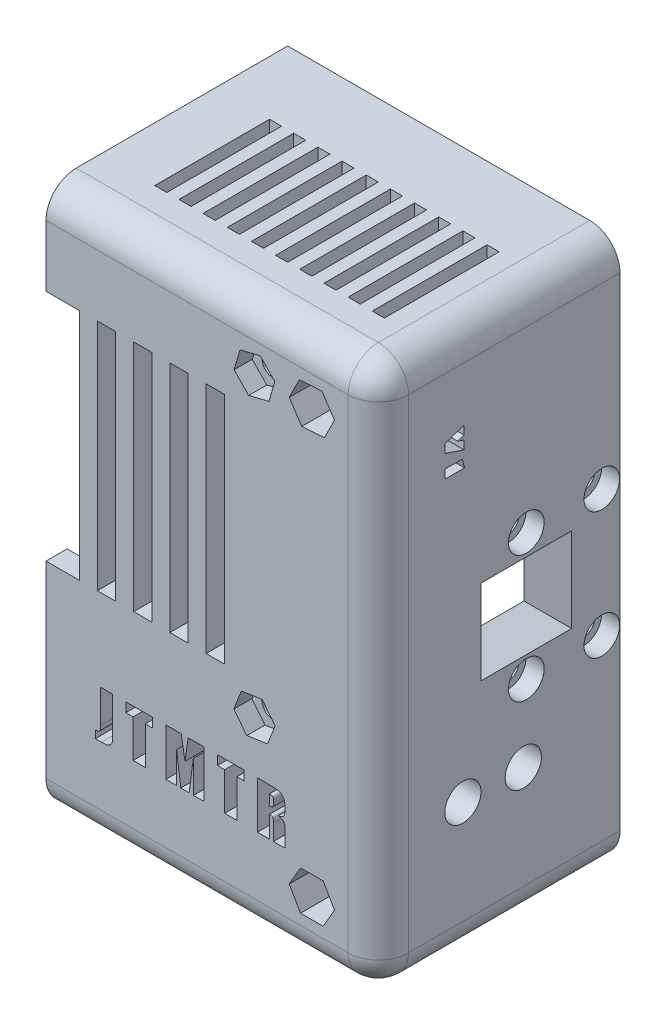
from build123d import *

# Parameters (mm, degrees)
SKETCH1_W                       = 110
SKETCH1_H                       = 90
SKETCH1_R                       = 1.75
BOSS_EXTRUDE1_DEPTH             = 5
SKETCH2_R                       = 3
BOSS_EXTRUDE2_DEPTH             = 8
CUT_EXTRUDE1_REACH              = 78.118
SKETCH3_R                       = 1.5
CUT_EXTRUDE2_DEPTH              = 3
SKETCH5_W                       = 5
SKETCH5_H                       = 90
BOSS_EXTRUDE3_DEPTH             = 35
CUT_EXTRUDE3_REACH              = 121.478
SKETCH6_W                       = 4.5
SKETCH6_H                       = 4
SKETCH6_R                       = 1.75
SKETCH7_R                       = 2.25
BOSS_EXTRUDE4_DEPTH             = 2
CUT_EXTRUDE4_REACH              = 119.724
SKETCH8_R                       = 1.5
SKETCH9_W                       = 105
SKETCH9_H                       = 4
BOSS_EXTRUDE5_DEPTH             = 35
CUT_EXTRUDE7_REACH              = 112.549
SKETCH13_W                      = 50
SKETCH13_H                      = 16
SKETCH15_W                      = 3
SKETCH15_H                      = 19.333856647
CUT_EXTRUDE9_DEPTH              = 10
SKETCH18_R                      = 5
BOSS_EXTRUDE7_DEPTH             = 35
CUT_EXTRUDE10_REACH             = 121.478
SKETCH20_R                      = 3
CUT_EXTRUDE11_REACH             = 87
SKETCH21_R                      = 1.75
CUT_EXTRUDE12_DEPTH             = 30
CUT_EXTRUDE13_REACH             = 112.549
SKETCH23_R                      = 2
CUT_EXTRUDE13_DIRECTION_2_REACH = 112.549
CUT_EXTRUDE14_DEPTH             = 3
CUT_EXTRUDE15_DEPTH             = 3
SKETCH27_R                      = 2.5
BOSS_EXTRUDE9_DEPTH             = 10
SKETCH28_R                      = 0.9
BOSS_EXTRUDE10_DEPTH            = 3
SKETCH29_W                      = 2
SKETCH29_H                      = 82
BOSS_EXTRUDE11_DEPTH            = 10
CUT_EXTRUDE16_DEPTH             = 10
FILLET3_R                       = 5
CUT_EXTRUDE17_START             = -10.5
CUT_EXTRUDE17_OUTLINE_W         = 38.667713294
CUT_EXTRUDE17_OUTLINE_H         = 5
CUT_EXTRUDE17_DEPTH             = 21
CUT_EXTRUDE17_START_2           = 55
CUT_EXTRUDE17_2_OUTLINE_W       = 38.667713294
CUT_EXTRUDE17_2_OUTLINE_H       = 5
CUT_EXTRUDE17_2_DEPTH           = 5
CUT_EXTRUDE17_START_3           = -51
CUT_EXTRUDE17_3_DEPTH           = 106.760910182
CUT_EXTRUDE17_4_ANGLE           = 90
CUT_EXTRUDE17_5_OUTLINE_W       = 5
CUT_EXTRUDE17_5_OUTLINE_H       = 38.667713294
CUT_EXTRUDE17_5_ANGLE           = 90
CHAMFER1_SIZE                   = 3
CHAMFER1_SIZE_2                 = 5.196152423
SKETCH34_W                      = 2
SKETCH34_H                      = 82
BOSS_EXTRUDE12_DEPTH            = 25
SKETCH35_W                      = 1
SKETCH35_H                      = 82
CUT_EXTRUDE18_DEPTH             = 10
CUT_EXTRUDE19_REACH             = 124.123
SKETCH36_W                      = 20
SKETCH36_H                      = 39
CUT_EXTRUDE21_REACH             = 84.765
SKETCH38_W                      = 14.5
SKETCH38_H                      = 10
CUT_EXTRUDE22_DEPTH             = 5
CUT_EXTRUDE30_DEPTH             = 5
CUT_EXTRUDE31_DEPTH             = 83.764726786
CUT_EXTRUDE31_DEPTH_BACK        = 83.764726786
SKETCH44_W                      = 55
SKETCH44_H                      = 90
SKETCH45_W                      = 26.5
SKETCH45_H                      = 86.0117121
CUT_EXTRUDE32_DEPTH             = 5
SKETCH46_W                      = 10
SKETCH46_H                      = 10
SKETCH46_H_2                    = 8
SKETCH46_H_3                    = 2
BOSS_EXTRUDE13_DEPTH            = 4
SKETCH47_W                      = 2
SKETCH47_H                      = 19
CUT_EXTRUDE33_DEPTH             = 10
SKETCH48_R                      = 2.95
CUT_EXTRUDE36_DEPTH             = 3
BOSS_EXTRUDE14_START            = -35
BOSS_EXTRUDE14_DEPTH            = 35


with BuildPart() as part:
    # Sketch1 → Boss-Extrude1 (new body)
    with BuildSketch(Plane.XY):
        with Locations((5, 0)):
            Rectangle(SKETCH1_W, SKETCH1_H)
        with Locations((39.5, 35)):
            Circle(SKETCH1_R, mode=Mode.SUBTRACT)
        with Locations((-18.5, 35)):
            Circle(SKETCH1_R, mode=Mode.SUBTRACT)
        with Locations((-18.5, -14)):
            Circle(SKETCH1_R, mode=Mode.SUBTRACT)
        with Locations((39.5, -14)):
            Circle(SKETCH1_R, mode=Mode.SUBTRACT)
    extrude(amount=BOSS_EXTRUDE1_DEPTH)

    # Sketch2 → Boss-Extrude2 (add)
    with BuildSketch(Plane(origin=(0, 0, 0), x_dir=(-1, 0, 0), z_dir=(0, 0, -1))):
        with Locations(Location((-39.5, 35, 0), (0, 0, 180))):
            Circle(SKETCH2_R)
        with Locations(Location((-39.5, -14, 0), (0, 0, 180))):
            Circle(SKETCH2_R)
        with Locations(Location((18.5, -14, 0), (0, 0, 180))):
            Circle(SKETCH2_R)
        with Locations(Location((18.5, 35, 0), (0, 0, 180))):
            Circle(SKETCH2_R)
    extrude(amount=BOSS_EXTRUDE2_DEPTH)

    # Sketch3 → Cut-Extrude1 (cut, up to next)
    with BuildSketch(Plane(origin=(0, 0, -8), x_dir=(-1, 0, 0), z_dir=(0, 0, -1)), mode=Mode.PRIVATE) as cut_extrude1_sk1:
        with Locations((-39.5, 35)):
            Circle(SKETCH3_R)
    cut_extrude1_tool1 = extrude(cut_extrude1_sk1.sketch, amount=-CUT_EXTRUDE1_REACH, mode=Mode.PRIVATE) & part.part
    # Sketch3 → Cut-Extrude1 (cut, up to next)
    with BuildSketch(Plane(origin=(0, 0, -8), x_dir=(-1, 0, 0), z_dir=(0, 0, -1)), mode=Mode.PRIVATE) as cut_extrude1_sk2:
        with Locations((18.5, 35)):
            Circle(SKETCH3_R)
    cut_extrude1_tool2 = extrude(cut_extrude1_sk2.sketch, amount=-CUT_EXTRUDE1_REACH, mode=Mode.PRIVATE) & part.part
    # Sketch3 → Cut-Extrude1 (cut, up to next)
    with BuildSketch(Plane(origin=(0, 0, -8), x_dir=(-1, 0, 0), z_dir=(0, 0, -1)), mode=Mode.PRIVATE) as cut_extrude1_sk3:
        with Locations((18.5, -14)):
            Circle(SKETCH3_R)
    cut_extrude1_tool3 = extrude(cut_extrude1_sk3.sketch, amount=-CUT_EXTRUDE1_REACH, mode=Mode.PRIVATE) & part.part
    # Sketch3 → Cut-Extrude1 (cut, up to next)
    with BuildSketch(Plane(origin=(0, 0, -8), x_dir=(-1, 0, 0), z_dir=(0, 0, -1)), mode=Mode.PRIVATE) as cut_extrude1_sk4:
        with Locations((-39.5, -14)):
            Circle(SKETCH3_R)
    cut_extrude1_tool4 = extrude(cut_extrude1_sk4.sketch, amount=-CUT_EXTRUDE1_REACH, mode=Mode.PRIVATE) & part.part
    add(cut_extrude1_tool1.solids().sort_by_distance((39.5, 35, -8))[0], mode=Mode.SUBTRACT)
    add(cut_extrude1_tool2.solids().sort_by_distance((-18.5, 35, -8))[0], mode=Mode.SUBTRACT)
    add(cut_extrude1_tool3.solids().sort_by_distance((-18.5, -14, -8))[0], mode=Mode.SUBTRACT)
    add(cut_extrude1_tool4.solids().sort_by_distance((39.5, -14, -8))[0], mode=Mode.SUBTRACT)

    # Sketch4 → Cut-Extrude2 (cut)
    with BuildSketch(Plane.XY.offset(5)):
        Polygon((-21.354132917, 33.036858311), (-18.226935885, 31.546677543), (-15.372802968, 33.509819232), (-15.645867083, 36.963141689), (-18.773064115, 38.453322457), (-21.627197032, 36.490180768), align=None)
        Polygon((38.538923104, 31.671887742), (41.901691314, 32.503626864), (42.86276821, 35.831739122), (40.461076896, 38.328112258), (37.098308686, 37.496373136), (36.13723179, 34.168260878), align=None)
        Polygon((38.235847366, -17.225200477), (41.661029228, -16.707388534), (42.925181863, -13.482188057), (40.764152634, -10.774799523), (37.338970772, -11.292611466), (36.074818137, -14.517811943), align=None)
        Polygon((-19.700941245, -17.249267629), (-16.286522312, -16.664679441), (-15.085581067, -13.415411812), (-17.299058755, -10.750732371), (-20.713477688, -11.335320559), (-21.914418933, -14.584588188), align=None)
    extrude(amount=-CUT_EXTRUDE2_DEPTH, mode=Mode.SUBTRACT)

    # Sketch5 → Boss-Extrude3 (add)
    with BuildSketch(Plane(origin=(0, 0, 0), x_dir=(-1, 0, 0), z_dir=(0, 0, -1))):
        with Locations((-57.5, 0)):
            Rectangle(SKETCH5_W, SKETCH5_H)
    extrude(amount=BOSS_EXTRUDE3_DEPTH)

    # Sketch6 → Cut-Extrude3 (cut, up to next)
    with BuildSketch(Plane.ZY.offset(-55), mode=Mode.PRIVATE) as cut_extrude3_sk1:
        with Locations((-17.25, -2)):
            Rectangle(SKETCH6_W, SKETCH6_H)
    cut_extrude3_tool1 = extrude(cut_extrude3_sk1.sketch, amount=-CUT_EXTRUDE3_REACH, mode=Mode.PRIVATE) & part.part
    # Sketch6 → Cut-Extrude3 (cut, up to next)
    with BuildSketch(Plane.ZY.offset(-55), mode=Mode.PRIVATE) as cut_extrude3_sk2:
        with Locations((-17.25, 2)):
            Rectangle(SKETCH6_W, SKETCH6_H)
    cut_extrude3_tool2 = extrude(cut_extrude3_sk2.sketch, amount=-CUT_EXTRUDE3_REACH, mode=Mode.PRIVATE) & part.part
    # Sketch6 → Cut-Extrude3 (cut, up to next)
    with BuildSketch(Plane.ZY.offset(-55), mode=Mode.PRIVATE) as cut_extrude3_sk3:
        with Locations((-21.75, 2)):
            Rectangle(SKETCH6_W, SKETCH6_H)
    cut_extrude3_tool3 = extrude(cut_extrude3_sk3.sketch, amount=-CUT_EXTRUDE3_REACH, mode=Mode.PRIVATE) & part.part
    # Sketch6 → Cut-Extrude3 (cut, up to next)
    with BuildSketch(Plane.ZY.offset(-55), mode=Mode.PRIVATE) as cut_extrude3_sk4:
        with Locations((-21.75, -2)):
            Rectangle(SKETCH6_W, SKETCH6_H)
    cut_extrude3_tool4 = extrude(cut_extrude3_sk4.sketch, amount=-CUT_EXTRUDE3_REACH, mode=Mode.PRIVATE) & part.part
    # Sketch6 → Cut-Extrude3 (cut, up to next)
    with BuildSketch(Plane.ZY.offset(-55), mode=Mode.PRIVATE) as cut_extrude3_sk5:
        with Locations(Location((-32, -10.5, 0), (0, 0, 270))):
            Circle(SKETCH6_R)
    cut_extrude3_tool5 = extrude(cut_extrude3_sk5.sketch, amount=-CUT_EXTRUDE3_REACH, mode=Mode.PRIVATE) & part.part
    # Sketch6 → Cut-Extrude3 (cut, up to next)
    with BuildSketch(Plane.ZY.offset(-55), mode=Mode.PRIVATE) as cut_extrude3_sk6:
        with Locations(Location((-32, 10.5, 0), (0, 0, 270))):
            Circle(SKETCH6_R)
    cut_extrude3_tool6 = extrude(cut_extrude3_sk6.sketch, amount=-CUT_EXTRUDE3_REACH, mode=Mode.PRIVATE) & part.part
    # Sketch6 → Cut-Extrude3 (cut, up to next)
    with BuildSketch(Plane.ZY.offset(-55), mode=Mode.PRIVATE) as cut_extrude3_sk7:
        with Locations(Location((-19.5, 10.5, 0), (0, 0, 270))):
            Circle(SKETCH6_R)
    cut_extrude3_tool7 = extrude(cut_extrude3_sk7.sketch, amount=-CUT_EXTRUDE3_REACH, mode=Mode.PRIVATE) & part.part
    # Sketch6 → Cut-Extrude3 (cut, up to next)
    with BuildSketch(Plane.ZY.offset(-55), mode=Mode.PRIVATE) as cut_extrude3_sk8:
        with Locations(Location((-19.5, -10.5, 0), (0, 0, 270))):
            Circle(SKETCH6_R)
    cut_extrude3_tool8 = extrude(cut_extrude3_sk8.sketch, amount=-CUT_EXTRUDE3_REACH, mode=Mode.PRIVATE) & part.part
    add(cut_extrude3_tool1.solids().sort_by_distance((55, -2, -17.25))[0], mode=Mode.SUBTRACT)
    add(cut_extrude3_tool2.solids().sort_by_distance((55, 2, -17.25))[0], mode=Mode.SUBTRACT)
    add(cut_extrude3_tool3.solids().sort_by_distance((55, 2, -21.75))[0], mode=Mode.SUBTRACT)
    add(cut_extrude3_tool4.solids().sort_by_distance((55, -2, -21.75))[0], mode=Mode.SUBTRACT)
    add(cut_extrude3_tool5.solids().sort_by_distance((55, -10.5, -32))[0], mode=Mode.SUBTRACT)
    add(cut_extrude3_tool6.solids().sort_by_distance((55, 10.5, -32))[0], mode=Mode.SUBTRACT)
    add(cut_extrude3_tool7.solids().sort_by_distance((55, 10.5, -19.5))[0], mode=Mode.SUBTRACT)
    add(cut_extrude3_tool8.solids().sort_by_distance((55, -10.5, -19.5))[0], mode=Mode.SUBTRACT)

    # Sketch7 → Boss-Extrude4 (add)
    with BuildSketch(Plane.ZY.offset(-55)):
        with Locations(Location((-19.5, 10.5, 0), (0, 0, 90))):
            Circle(SKETCH7_R)
        with Locations(Location((-19.5, -10.5, 0), (0, 0, 90))):
            Circle(SKETCH7_R)
        with Locations(Location((-32, -10.5, 0), (0, 0, 90))):
            Circle(SKETCH7_R)
        with Locations(Location((-32, 10.5, 0), (0, 0, 90))):
            Circle(SKETCH7_R)
    extrude(amount=BOSS_EXTRUDE4_DEPTH)

    # Sketch8 → Cut-Extrude4 (cut, up to next)
    with BuildSketch(Plane.ZY.offset(-53), mode=Mode.PRIVATE) as cut_extrude4_sk1:
        with Locations(Location((-32, 10.5, 0), (0, 0, 270))):
            Circle(SKETCH8_R)
    cut_extrude4_tool1 = extrude(cut_extrude4_sk1.sketch, amount=-CUT_EXTRUDE4_REACH, mode=Mode.PRIVATE) & part.part
    # Sketch8 → Cut-Extrude4 (cut, up to next)
    with BuildSketch(Plane.ZY.offset(-53), mode=Mode.PRIVATE) as cut_extrude4_sk2:
        with Locations(Location((-19.5, 10.5, 0), (0, 0, 270))):
            Circle(SKETCH8_R)
    cut_extrude4_tool2 = extrude(cut_extrude4_sk2.sketch, amount=-CUT_EXTRUDE4_REACH, mode=Mode.PRIVATE) & part.part
    # Sketch8 → Cut-Extrude4 (cut, up to next)
    with BuildSketch(Plane.ZY.offset(-53), mode=Mode.PRIVATE) as cut_extrude4_sk3:
        with Locations(Location((-19.5, -10.5, 0), (0, 0, 270))):
            Circle(SKETCH8_R)
    cut_extrude4_tool3 = extrude(cut_extrude4_sk3.sketch, amount=-CUT_EXTRUDE4_REACH, mode=Mode.PRIVATE) & part.part
    # Sketch8 → Cut-Extrude4 (cut, up to next)
    with BuildSketch(Plane.ZY.offset(-53), mode=Mode.PRIVATE) as cut_extrude4_sk4:
        with Locations(Location((-32, -10.5, 0), (0, 0, 270))):
            Circle(SKETCH8_R)
    cut_extrude4_tool4 = extrude(cut_extrude4_sk4.sketch, amount=-CUT_EXTRUDE4_REACH, mode=Mode.PRIVATE) & part.part
    add(cut_extrude4_tool1.solids().sort_by_distance((53, 10.5, -32))[0], mode=Mode.SUBTRACT)
    add(cut_extrude4_tool2.solids().sort_by_distance((53, 10.5, -19.5))[0], mode=Mode.SUBTRACT)
    add(cut_extrude4_tool3.solids().sort_by_distance((53, -10.5, -19.5))[0], mode=Mode.SUBTRACT)
    add(cut_extrude4_tool4.solids().sort_by_distance((53, -10.5, -32))[0], mode=Mode.SUBTRACT)

    # Sketch9 → Boss-Extrude5 (add)
    with BuildSketch(Plane(origin=(0, 0, 0), x_dir=(-1, 0, 0), z_dir=(0, 0, -1))):
        with Locations((-2.5, 43)):
            Rectangle(SKETCH9_W, SKETCH9_H)
        with Locations((-2.5, -43)):
            Rectangle(SKETCH9_W, SKETCH9_H)
    extrude(amount=BOSS_EXTRUDE5_DEPTH)

    # Sketch13 → Cut-Extrude7 (cut, up to next)
    with BuildSketch(Plane(origin=(0, -41, 0), x_dir=(1, 0, 0), z_dir=(0, 1, 0)), mode=Mode.PRIVATE) as cut_extrude7_sk1:
        with Locations((18, 12)):
            Rectangle(SKETCH13_W, SKETCH13_H)
    cut_extrude7_tool1 = extrude(cut_extrude7_sk1.sketch, amount=-CUT_EXTRUDE7_REACH, mode=Mode.PRIVATE) & part.part
    add(cut_extrude7_tool1.solids().sort_by_distance((18, -41, -12))[0], mode=Mode.SUBTRACT)

    # Sketch15 → Cut-Extrude9 (cut)
    with BuildSketch(Plane.XY.offset(5)):
        with Locations((-15, 0.833071676)):
            Rectangle(SKETCH15_W, SKETCH15_H)
        with Locations((-9, 0.833071676)):
            Rectangle(SKETCH15_W, SKETCH15_H)
        with Locations((-3, 0.833071676)):
            Rectangle(SKETCH15_W, SKETCH15_H)
        with Locations((3, 0.833071676)):
            Rectangle(SKETCH15_W, SKETCH15_H)
        with Locations((9, 0.833071676)):
            Rectangle(SKETCH15_W, SKETCH15_H)
        with Locations((15, 0.833071676)):
            Rectangle(SKETCH15_W, SKETCH15_H)
        with Locations((21, 0.833071676)):
            Rectangle(SKETCH15_W, SKETCH15_H)
        with Locations((27, 0.833071676)):
            Rectangle(SKETCH15_W, SKETCH15_H)
        with Locations((33, 0.833071676)):
            Rectangle(SKETCH15_W, SKETCH15_H)
        with Locations((-15, 20.166928324)):
            Rectangle(SKETCH15_W, SKETCH15_H)
        with Locations((-9, 20.166928324)):
            Rectangle(SKETCH15_W, SKETCH15_H)
        with Locations((-3, 20.166928324)):
            Rectangle(SKETCH15_W, SKETCH15_H)
        with Locations((3, 20.166928324)):
            Rectangle(SKETCH15_W, SKETCH15_H)
        with Locations((9, 20.166928324)):
            Rectangle(SKETCH15_W, SKETCH15_H)
        with Locations((15, 20.166928324)):
            Rectangle(SKETCH15_W, SKETCH15_H)
        with Locations((21, 20.166928324)):
            Rectangle(SKETCH15_W, SKETCH15_H)
        with Locations((27, 20.166928324)):
            Rectangle(SKETCH15_W, SKETCH15_H)
        with Locations((33, 20.166928324)):
            Rectangle(SKETCH15_W, SKETCH15_H)
    extrude(amount=-CUT_EXTRUDE9_DEPTH, mode=Mode.SUBTRACT)

    # Sketch18 → Boss-Extrude7 (add)
    with BuildSketch(Plane(origin=(0, 0, 0), x_dir=(-1, 0, 0), z_dir=(0, 0, -1))):
        with Locations(Location((-49, -35, 0), (0, 0, 180))):
            Circle(SKETCH18_R)
        with Locations(Location((-49, 35, 0), (0, 0, 180))):
            Circle(SKETCH18_R)
    extrude(amount=BOSS_EXTRUDE7_DEPTH)

    # Sketch20 → Cut-Extrude10 (cut, up to next)
    with BuildSketch(Plane.ZY.offset(-55), mode=Mode.PRIVATE) as cut_extrude10_sk1:
        with Locations(Location((-19, -22.892244298, 0), (0, 0, 270))):
            Circle(SKETCH20_R)
    cut_extrude10_tool1 = extrude(cut_extrude10_sk1.sketch, amount=-CUT_EXTRUDE10_REACH, mode=Mode.PRIVATE) & part.part
    # Sketch20 → Cut-Extrude10 (cut, up to next)
    with BuildSketch(Plane.ZY.offset(-55), mode=Mode.PRIVATE) as cut_extrude10_sk2:
        with Locations(Location((-9, -22.892244298, 0), (0, 0, 270))):
            Circle(SKETCH20_R)
    cut_extrude10_tool2 = extrude(cut_extrude10_sk2.sketch, amount=-CUT_EXTRUDE10_REACH, mode=Mode.PRIVATE) & part.part
    add(cut_extrude10_tool1.solids().sort_by_distance((55, -22.892244, -19))[0], mode=Mode.SUBTRACT)
    add(cut_extrude10_tool2.solids().sort_by_distance((55, -22.892244, -9))[0], mode=Mode.SUBTRACT)

    # Sketch21 → Cut-Extrude11 (cut, up to next)
    with BuildSketch(Plane(origin=(0, 0, -35), x_dir=(-1, 0, 0), z_dir=(0, 0, -1)), mode=Mode.PRIVATE) as cut_extrude11_sk1:
        with Locations((-49, 35)):
            Circle(SKETCH21_R)
    cut_extrude11_tool1 = extrude(cut_extrude11_sk1.sketch, amount=-CUT_EXTRUDE11_REACH, mode=Mode.PRIVATE) & part.part
    # Sketch21 → Cut-Extrude11 (cut, up to next)
    with BuildSketch(Plane(origin=(0, 0, -35), x_dir=(-1, 0, 0), z_dir=(0, 0, -1)), mode=Mode.PRIVATE) as cut_extrude11_sk2:
        with Locations((-49, -35)):
            Circle(SKETCH21_R)
    cut_extrude11_tool2 = extrude(cut_extrude11_sk2.sketch, amount=-CUT_EXTRUDE11_REACH, mode=Mode.PRIVATE) & part.part
    add(cut_extrude11_tool1.solids().sort_by_distance((49, 35, -35))[0], mode=Mode.SUBTRACT)
    add(cut_extrude11_tool2.solids().sort_by_distance((49, -35, -35))[0], mode=Mode.SUBTRACT)

    # Sketch22 → Cut-Extrude12 (cut)
    with BuildSketch(Plane.XY.offset(5)):
        Polygon((46.919353747, 38.12317859), (45.254924874, 34.759696783), (47.335571127, 31.636518194), (51.080646253, 31.87682141), (52.745075126, 35.240303217), (50.664428873, 38.363481806), align=None)
        Polygon((52.75277675, -35), (50.876388375, -31.75), (47.123611625, -31.75), (45.24722325, -35), (47.123611625, -38.25), (50.876388375, -38.25), align=None)
    extrude(amount=-CUT_EXTRUDE12_DEPTH, mode=Mode.SUBTRACT)

    # Sketch23 → Cut-Extrude13 (cut, up to next)
    with BuildSketch(Plane(origin=(0, -41, 0), x_dir=(1, 0, 0), z_dir=(0, 1, 0)), mode=Mode.PRIVATE) as cut_extrude13_sk1:
        with Locations(Location((-20, 15, 0), (0, 0, 90))):
            Circle(SKETCH23_R)
    cut_extrude13_tool1 = extrude(cut_extrude13_sk1.sketch, amount=-CUT_EXTRUDE13_REACH, mode=Mode.PRIVATE) & part.part
    add(cut_extrude13_tool1.solids().sort_by_distance((-20, -41, -15))[0], mode=Mode.SUBTRACT)

    # Sketch23 → Cut-Extrude13 direction 2 (cut, up to next)
    with BuildSketch(Plane(origin=(0, -41, 0), x_dir=(1, 0, 0), z_dir=(0, 1, 0)), mode=Mode.PRIVATE) as cut_extrude13_direction_2_sk1:
        with Locations(Location((-20, 15, 0), (0, 0, 90))):
            Circle(SKETCH23_R)
    cut_extrude13_direction_2_tool1 = extrude(cut_extrude13_direction_2_sk1.sketch, amount=CUT_EXTRUDE13_DIRECTION_2_REACH, mode=Mode.PRIVATE) & part.part
    add(cut_extrude13_direction_2_tool1.solids().sort_by_distance((-20, -41, -15))[0], mode=Mode.SUBTRACT)

    # Sketch24 → Cut-Extrude14 (cut)
    with BuildSketch(Plane(origin=(0, 41, 0), x_dir=(-1, 0, 0), z_dir=(0, -1, 0))):
        Polygon((16.535898385, 15), (18.267949192, 12), (21.732050808, 12), (23.464101615, 15), (21.732050808, 18), (18.267949192, 18), align=None)
    extrude(amount=-CUT_EXTRUDE14_DEPTH, mode=Mode.SUBTRACT)

    # Sketch25 → Cut-Extrude15 (cut)
    with BuildSketch(Plane(origin=(0, -41, 0), x_dir=(1, 0, 0), z_dir=(0, 1, 0))):
        Polygon((-23.452057687, 14.711386547), (-21.476082261, 11.866123621), (-18.024024574, 12.154737074), (-16.547942313, 15.288613453), (-18.523917739, 18.133876379), (-21.975975426, 17.845262926), align=None)
    extrude(amount=-CUT_EXTRUDE15_DEPTH, mode=Mode.SUBTRACT)

    # Sketch27 → Boss-Extrude9 (add)
    with BuildSketch(Plane(origin=(0, 0, 0), x_dir=(-1, 0, 0), z_dir=(0, 0, -1))):
        with Locations(Location((4.68, -22, 0), (0, 0, 180))):
            Circle(SKETCH27_R)
        with Locations(Location((4.68, -37.24, 0), (0, 0, 180))):
            Circle(SKETCH27_R)
        with Locations(Location((45.32, -37.24, 0), (0, 0, 180))):
            Circle(SKETCH27_R)
        with Locations(Location((45.32, -22, 0), (0, 0, 180))):
            Circle(SKETCH27_R)
    extrude(amount=BOSS_EXTRUDE9_DEPTH)

    # Sketch28 → Boss-Extrude10 (add)
    with BuildSketch(Plane(origin=(0, 0, -10), x_dir=(-1, 0, 0), z_dir=(0, 0, -1))):
        with Locations((4.68, -22)):
            Circle(SKETCH28_R)
        with Locations((4.68, -37.24)):
            Circle(SKETCH28_R)
        with Locations((45.32, -37.24)):
            Circle(SKETCH28_R)
        with Locations((45.32, -22)):
            Circle(SKETCH28_R)
    extrude(amount=BOSS_EXTRUDE10_DEPTH)

    # Sketch29 → Boss-Extrude11 (add)
    with BuildSketch(Plane(origin=(0, 0, 0), x_dir=(-1, 0, 0), z_dir=(0, 0, -1))):
        with Locations((49, 0)):
            Rectangle(SKETCH29_W, SKETCH29_H)
    extrude(amount=BOSS_EXTRUDE11_DEPTH)

    # Sketch30 → Cut-Extrude16 (cut)
    with BuildSketch(Plane(origin=(0, 0, -35), x_dir=(-1, 0, 0), z_dir=(0, 0, -1))):
        Polygon((-55, 41), (50, 41), (50, 43), (-57, 43), (-57, 15), (-55, 15), align=None)
        Polygon((50, -43), (50, -41), (-55, -41), (-55, -15), (-57, -15), (-57, -43), align=None)
    extrude(amount=-CUT_EXTRUDE16_DEPTH, mode=Mode.SUBTRACT)

    # Fillet3
    fillet3_edges = [part.edges().sort_by_distance(p)[0] for p in [
        (60, 45, -15),
        (60, -45, -15),
    ]]
    fillet(fillet3_edges, radius=FILLET3_R)

    # Cut-Extrude17: read off the stored shape, not the designer's step
    # Cut-Extrude17 outline → Cut-Extrude17 (cut)
    with BuildSketch(Plane.YZ.offset(CUT_EXTRUDE17_START)):
        with BuildLine():
            ThreePointArc((-45, 0), (-43.535533906, 3.535533906), (-40, 5))
            Line((-40, 5), (-45, 5))
            Line((-45, 5), (-45, 0))
        make_face()
        with BuildLine():
            Line((45, 5), (40, 5))
            ThreePointArc((40, 5), (43.535533906, 3.535533906), (45, 0))
            Line((45, 0), (45, 5))
        make_face()
        with Locations((10.5, 2.5)):
            Rectangle(CUT_EXTRUDE17_OUTLINE_W, CUT_EXTRUDE17_OUTLINE_H)
    extrude(amount=CUT_EXTRUDE17_DEPTH, mode=Mode.SUBTRACT)

    # Cut-Extrude17 2 outline → Cut-Extrude17 2 (cut)
    with BuildSketch(Plane.YZ.offset(CUT_EXTRUDE17_START_2)):
        with BuildLine():
            ThreePointArc((-45, 0), (-43.535533906, 3.535533906), (-40, 5))
            Line((-40, 5), (-45, 5))
            Line((-45, 5), (-45, 0))
        make_face()
        with BuildLine():
            Line((45, 5), (40, 5))
            ThreePointArc((40, 5), (43.535533906, 3.535533906), (45, 0))
            Line((45, 0), (45, 5))
        make_face()
        with Locations((10.5, 2.5)):
            Rectangle(CUT_EXTRUDE17_2_OUTLINE_W, CUT_EXTRUDE17_2_OUTLINE_H)
    extrude(amount=CUT_EXTRUDE17_2_DEPTH, mode=Mode.SUBTRACT)

    # Cut-Extrude17 3 outline → Cut-Extrude17 3 (cut)
    with BuildSketch(Plane.YZ.offset(CUT_EXTRUDE17_START_3)):
        with BuildLine():
            ThreePointArc((-45, 0), (-43.535533906, 3.535533906), (-40, 5))
            Line((-40, 5), (-45, 5))
            Line((-45, 5), (-45, 0))
        make_face()
        with BuildLine():
            Line((45, 5), (40, 5))
            ThreePointArc((40, 5), (43.535533906, 3.535533906), (45, 0))
            Line((45, 0), (45, 5))
        make_face()
    extrude(amount=CUT_EXTRUDE17_3_DEPTH, mode=Mode.SUBTRACT)

    # Cut-Extrude17 4 outline → Cut-Extrude17 4 (revolve, cut)
    with BuildSketch(Plane.ZY.offset(-55)):
        with BuildLine():
            Line((7.071067812, 45), (0, 45))
            ThreePointArc((0, 45), (3.535533906, 43.535533906), (5, 40))
            Line((5, 40), (5, 29.833856647))
            Line((5, 29.833856647), (7.071067812, 29.833856647))
            Line((7.071067812, 29.833856647), (7.071067812, 45))
        make_face()
        with BuildLine():
            Line((7.071067812, -8.833856647), (5, -8.833856647))
            Line((5, -8.833856647), (5, -40))
            ThreePointArc((5, -40), (3.535533906, -43.535533906), (0, -45))
            Line((0, -45), (7.071067812, -45))
            Line((7.071067812, -45), (7.071067812, -8.833856647))
        make_face()
    revolve(axis=Axis((55, 0, 0), (0, 1, 0)), revolution_arc=CUT_EXTRUDE17_4_ANGLE, mode=Mode.SUBTRACT)

    # Cut-Extrude17 5 outline → Cut-Extrude17 5 (revolve)
    with BuildSketch(Plane.ZY.offset(-55)):
        with Locations((2.5, 10.5)):
            Rectangle(CUT_EXTRUDE17_5_OUTLINE_W, CUT_EXTRUDE17_5_OUTLINE_H)
    revolve(axis=Axis((55, 0, 0), (0, 1, 0)), revolution_arc=CUT_EXTRUDE17_5_ANGLE)

    # Chamfer1
    # the kernel refuses this chamfer: 5.196152423, 3 mm, written as the material it takes off along each edge
    with BuildSketch(Plane(origin=(60, -4, -15), x_dir=(0, 0, 1), z_dir=(0, 1, 0)), Plane(origin=(60, 4, -24), x_dir=(0, 0, -1), z_dir=(0, -1, 0))) as chamfer1_piece_1:
        Polygon((CHAMFER1_SIZE, 0), (0, -CHAMFER1_SIZE_2), (0, 0), align=None)
    extrude(amount=8, mode=Mode.SUBTRACT)
    with BuildSketch(Plane(origin=(60, 4, -15), x_dir=(0, 1, 0), z_dir=(0, 0, -1)), Plane(origin=(60, -4, -24), x_dir=(0, -1, 0), z_dir=(0, 0, 1))) as chamfer1_piece_2:
        Polygon((CHAMFER1_SIZE, 0), (0, -CHAMFER1_SIZE_2), (0, 0), align=None)
    extrude(amount=9, mode=Mode.SUBTRACT)
    with BuildSketch(Plane(origin=(60, -4, -24), x_dir=(0, -1, 0), z_dir=(0, 0, 1))) as chamfer1_piece_3a_section:
        Polygon((CHAMFER1_SIZE, 0), (0, -CHAMFER1_SIZE_2), (0, 0), align=None)
    chamfer1_piece_3a = extrude(amount=22.442891912, mode=Mode.PRIVATE)
    chamfer1_piece_3a = split(chamfer1_piece_3a, bisect_by=Plane(origin=(60, -4, -15), z_dir=(0, 0, 1)), keep=Keep.TOP, mode=Mode.PRIVATE)
    with BuildSketch(Plane(origin=(60, -17.442891912, -15), x_dir=(0, 0, 1), z_dir=(0, 1, 0))) as chamfer1_piece_3b_section:
        Polygon((CHAMFER1_SIZE, 0), (0, -CHAMFER1_SIZE_2), (0, 0), align=None)
    chamfer1_piece_3b = extrude(amount=21.442891912, mode=Mode.PRIVATE)
    chamfer1_piece_3b = split(chamfer1_piece_3b, bisect_by=Plane(origin=(60, -4, -15), z_dir=(0, -1, 0)), keep=Keep.TOP, mode=Mode.PRIVATE)
    chamfer1_piece_3 = chamfer1_piece_3a & chamfer1_piece_3b
    add(chamfer1_piece_3, mode=Mode.SUBTRACT)
    with BuildSketch(Plane(origin=(60, 4, -1.557108088), x_dir=(0, 1, 0), z_dir=(0, 0, -1))) as chamfer1_piece_4a_section:
        Polygon((CHAMFER1_SIZE, 0), (0, -CHAMFER1_SIZE_2), (0, 0), align=None)
    chamfer1_piece_4a = extrude(amount=22.442891912, mode=Mode.PRIVATE)
    chamfer1_piece_4a = split(chamfer1_piece_4a, bisect_by=Plane(origin=(60, 4, -15), z_dir=(0, 0, 1)), keep=Keep.TOP, mode=Mode.PRIVATE)
    with BuildSketch(Plane(origin=(60, -4, -15), x_dir=(0, 0, 1), z_dir=(0, 1, 0))) as chamfer1_piece_4b_section:
        Polygon((CHAMFER1_SIZE, 0), (0, -CHAMFER1_SIZE_2), (0, 0), align=None)
    chamfer1_piece_4b = extrude(amount=21.442891912, mode=Mode.PRIVATE)
    chamfer1_piece_4b = split(chamfer1_piece_4b, bisect_by=Plane(origin=(60, 4, -15), z_dir=(0, 1, 0)), keep=Keep.TOP, mode=Mode.PRIVATE)
    chamfer1_piece_4 = chamfer1_piece_4a & chamfer1_piece_4b
    add(chamfer1_piece_4, mode=Mode.SUBTRACT)
    with BuildSketch(Plane(origin=(60, 17.442891912, -24), x_dir=(0, 0, -1), z_dir=(0, -1, 0))) as chamfer1_piece_5a_section:
        Polygon((CHAMFER1_SIZE, 0), (0, -CHAMFER1_SIZE_2), (0, 0), align=None)
    chamfer1_piece_5a = extrude(amount=21.442891912, mode=Mode.PRIVATE)
    chamfer1_piece_5a = split(chamfer1_piece_5a, bisect_by=Plane(origin=(60, 4, -24), z_dir=(0, 1, 0)), keep=Keep.TOP, mode=Mode.PRIVATE)
    with BuildSketch(Plane(origin=(60, 4, -15), x_dir=(0, 1, 0), z_dir=(0, 0, -1))) as chamfer1_piece_5b_section:
        Polygon((CHAMFER1_SIZE, 0), (0, -CHAMFER1_SIZE_2), (0, 0), align=None)
    chamfer1_piece_5b = extrude(amount=22.442891912, mode=Mode.PRIVATE)
    chamfer1_piece_5b = split(chamfer1_piece_5b, bisect_by=Plane(origin=(60, 4, -24), z_dir=(0, 0, -1)), keep=Keep.TOP, mode=Mode.PRIVATE)
    chamfer1_piece_5 = chamfer1_piece_5a & chamfer1_piece_5b
    add(chamfer1_piece_5, mode=Mode.SUBTRACT)
    with BuildSketch(Plane(origin=(60, -4, -37.442891912), x_dir=(0, -1, 0), z_dir=(0, 0, 1))) as chamfer1_piece_6a_section:
        Polygon((CHAMFER1_SIZE, 0), (0, -CHAMFER1_SIZE_2), (0, 0), align=None)
    chamfer1_piece_6a = extrude(amount=22.442891912, mode=Mode.PRIVATE)
    chamfer1_piece_6a = split(chamfer1_piece_6a, bisect_by=Plane(origin=(60, -4, -24), z_dir=(0, 0, -1)), keep=Keep.TOP, mode=Mode.PRIVATE)
    with BuildSketch(Plane(origin=(60, 4, -24), x_dir=(0, 0, -1), z_dir=(0, -1, 0))) as chamfer1_piece_6b_section:
        Polygon((CHAMFER1_SIZE, 0), (0, -CHAMFER1_SIZE_2), (0, 0), align=None)
    chamfer1_piece_6b = extrude(amount=21.442891912, mode=Mode.PRIVATE)
    chamfer1_piece_6b = split(chamfer1_piece_6b, bisect_by=Plane(origin=(60, -4, -24), z_dir=(0, -1, 0)), keep=Keep.TOP, mode=Mode.PRIVATE)
    chamfer1_piece_6 = chamfer1_piece_6a & chamfer1_piece_6b
    add(chamfer1_piece_6, mode=Mode.SUBTRACT)

    # Sketch34 → Boss-Extrude12 (add)
    with BuildSketch(Plane(origin=(0, 0, -10), x_dir=(-1, 0, 0), z_dir=(0, 0, -1))):
        with Locations((49, 0)):
            Rectangle(SKETCH34_W, SKETCH34_H)
    extrude(amount=BOSS_EXTRUDE12_DEPTH)

    # Sketch35 → Cut-Extrude18 (cut)
    with BuildSketch(Plane(origin=(0, 0, -35), x_dir=(-1, 0, 0), z_dir=(0, 0, -1))):
        with Locations((48.5, 0)):
            Rectangle(SKETCH35_W, SKETCH35_H)
    extrude(amount=-CUT_EXTRUDE18_DEPTH, mode=Mode.SUBTRACT)

    # Sketch36 → Cut-Extrude19 (cut, up to next)
    with BuildSketch(Plane(origin=(-48, 0, 0), x_dir=(0, 0, -1), z_dir=(1, 0, 0)), mode=Mode.PRIVATE) as cut_extrude19_sk1:
        with Locations((12.5, -19.5)):
            Rectangle(SKETCH36_W, SKETCH36_H)
    cut_extrude19_tool1 = extrude(cut_extrude19_sk1.sketch, amount=-CUT_EXTRUDE19_REACH, mode=Mode.PRIVATE) & part.part
    # Sketch36 → Cut-Extrude19 (cut, up to next)
    with BuildSketch(Plane(origin=(-48, 0, 0), x_dir=(0, 0, -1), z_dir=(1, 0, 0)), mode=Mode.PRIVATE) as cut_extrude19_sk2:
        with Locations((12.5, 19.5)):
            Rectangle(SKETCH36_W, SKETCH36_H)
    cut_extrude19_tool2 = extrude(cut_extrude19_sk2.sketch, amount=-CUT_EXTRUDE19_REACH, mode=Mode.PRIVATE) & part.part
    add(cut_extrude19_tool1.solids().sort_by_distance((-48, -19.5, -12.5))[0], mode=Mode.SUBTRACT)
    add(cut_extrude19_tool2.solids().sort_by_distance((-48, 19.5, -12.5))[0], mode=Mode.SUBTRACT)

    # Sketch37 → Cut-Extrude21 (cut, up to next)
    with BuildSketch(Plane(origin=(0, 0, 0), x_dir=(-1, 0, 0), z_dir=(0, 0, -1)), mode=Mode.PRIVATE) as cut_extrude21_sk1:
        with BuildLine():
            Line((-16.008983246, -22.399155147), (-16.008983246, -27.618321299))
            add(Edge.make_bspline(
                [(-16.008983246, -27.618321299), (-16.009057182, -27.711622873), (-16.009198229, -27.88961492), (-16.008249076, -28.14321668), (-16.004009225, -28.370464643), (-16.004414919, -28.571949041), (-15.998908068, -28.747512448), (-15.995686969, -28.89685425), (-15.989156465, -29.019781379), (-15.983261103, -29.148094775), (-15.963281422, -29.289043856), (-15.914513211, -29.445718564), (-15.845774987, -29.595600652), (-15.751926122, -29.733446473), (-15.641299879, -29.858724853), (-15.511109604, -29.963594394), (-15.364931791, -30.047688208), (-15.229657725, -30.098195239), (-15.111734652, -30.131023366), (-15.010641277, -30.149780119), (-14.899382792, -30.169338418), (-14.777077396, -30.182633709), (-14.644578705, -30.194904842), (-14.501337718, -30.200639198), (-14.347315937, -30.207642044), (-14.241041644, -30.207751759), (-14.18600717, -30.207808576)],
                knots=[0, 0, 0, 0, 1.738774286, 3.317071518, 4.726037395, 5.97442001, 7.071511504, 7.999243532, 8.758009548, 9.365399479, 10.393153955, 11.400119887, 12.41338286, 13.454549495, 14.496441349, 15.517209498, 16.555738183, 17.625493024, 18.198739376, 18.835275869, 19.540379274, 20.303533674, 21.126974116, 22.01976714, 22.974530243, 24, 24, 24, 24], degree=3))
            Line((-14.18600717, -30.207808576), (-13.161121408, -30.207808576))
            Line((-13.161121408, -30.207808576), (-13.161121408, -28.90732328))
            add(Edge.make_bspline(
                [(-13.161121408, -28.90732328), (-13.191740957, -28.90928158), (-13.248185201, -28.912891519), (-13.326174995, -28.917251756), (-13.390290719, -28.920279916), (-13.428585091, -28.921252191), (-13.445333426, -28.921677423)],
                knots=[0, 0, 0, 0, 1.293708501, 2.384829249, 3.293592805, 4, 4, 4, 4], degree=3))
            add(Edge.make_bspline(
                [(-13.445333426, -28.921677423), (-13.482275536, -28.92034463), (-13.5524561, -28.917812665), (-13.651406382, -28.897759149), (-13.738038025, -28.864595433), (-13.812385268, -28.818465393), (-13.872241643, -28.760825018), (-13.919391676, -28.696910139), (-13.952047462, -28.62660223), (-13.969042486, -28.544887068), (-13.978355497, -28.44295082), (-13.982622953, -28.309734629), (-13.987512383, -28.140368135), (-13.987775736, -28.015458822), (-13.987920006, -27.947031158)],
                knots=[0, 0, 0, 0, 1.017313736, 1.932635971, 2.767513323, 3.561301267, 4.325979076, 5.043271674, 5.739412137, 6.443003478, 7.331146155, 8.558401061, 10.114627581, 12, 12, 12, 12], degree=3))
            Line((-13.987920006, -27.947031158), (-13.987920006, -22.399155147))
            Line((-13.987920006, -22.399155147), (-16.008983246, -22.399155147))
        make_face()
    cut_extrude21_tool1 = extrude(cut_extrude21_sk1.sketch, amount=-CUT_EXTRUDE21_REACH, mode=Mode.PRIVATE) & part.part
    # Sketch37 → Cut-Extrude21 (cut, up to next)
    with BuildSketch(Plane(origin=(0, 0, 0), x_dir=(-1, 0, 0), z_dir=(0, 0, -1)), mode=Mode.PRIVATE) as cut_extrude21_sk2:
        Polygon((-22.623372033, -22.399155147), (-22.623372033, -23.960885832), (-21.429107391, -23.960885832), (-21.429107391, -30.207808576), (-19.408044151, -30.207808576), (-19.408044151, -23.960885832), (-18.213779509, -23.960885832), (-18.213779509, -22.399155147), align=None)
    cut_extrude21_tool2 = extrude(cut_extrude21_sk2.sketch, amount=-CUT_EXTRUDE21_REACH, mode=Mode.PRIVATE) & part.part
    # Sketch37 → Cut-Extrude21 (cut, up to next)
    with BuildSketch(Plane(origin=(0, 0, 0), x_dir=(-1, 0, 0), z_dir=(0, 0, -1)), mode=Mode.PRIVATE) as cut_extrude21_sk3:
        with BuildLine():
            Line((-31.166957549, -22.399155147), (-31.166957549, -30.207808576))
            Line((-31.166957549, -30.207808576), (-29.421493842, -30.207808576))
            Line((-29.421493842, -30.207808576), (-29.375560586, -24.935532097))
            Line((-29.375560586, -24.935532097), (-28.686561754, -30.207808576))
            Line((-28.686561754, -30.207808576), (-27.30856409, -30.207808576))
            Line((-27.30856409, -30.207808576), (-26.619565259, -25.027398608))
            Line((-26.619565259, -25.027398608), (-26.573632003, -30.207808576))
            Line((-26.573632003, -30.207808576), (-24.828168295, -30.207808576))
            Line((-24.828168295, -30.207808576), (-24.828168295, -22.399155147))
            Line((-24.828168295, -22.399155147), (-27.377463974, -22.399155147))
            add(Edge.make_bspline(
                [(-27.377463974, -22.399155147), (-27.39849492, -22.520212174), (-27.442468716, -22.773331412), (-27.511649473, -23.16889627), (-27.584497354, -23.597272465), (-27.635320032, -23.89342826), (-27.661675992, -24.047010686)],
                knots=[0, 0, 0, 0, 0.881745717, 1.843650135, 2.881745852, 4, 4, 4, 4], degree=3))
            Line((-27.661675992, -24.047010686), (-27.997562922, -26.045107299))
            Line((-27.997562922, -26.045107299), (-28.52579536, -22.399155147))
            Line((-28.52579536, -22.399155147), (-31.166957549, -22.399155147))
        make_face()
    cut_extrude21_tool3 = extrude(cut_extrude21_sk3.sketch, amount=-CUT_EXTRUDE21_REACH, mode=Mode.PRIVATE) & part.part
    # Sketch37 → Cut-Extrude21 (cut, up to next)
    with BuildSketch(Plane(origin=(0, 0, 0), x_dir=(-1, 0, 0), z_dir=(0, 0, -1)), mode=Mode.PRIVATE) as cut_extrude21_sk4:
        Polygon((-37.781346336, -22.399155147), (-37.781346336, -23.960885832), (-36.587081694, -23.960885832), (-36.587081694, -30.207808576), (-34.566018454, -30.207808576), (-34.566018454, -23.960885832), (-33.371753812, -23.960885832), (-33.371753812, -22.399155147), align=None)
    cut_extrude21_tool4 = extrude(cut_extrude21_sk4.sketch, amount=-CUT_EXTRUDE21_REACH, mode=Mode.PRIVATE) & part.part
    # Sketch37 → Cut-Extrude21 (cut, up to next)
    with BuildSketch(Plane(origin=(0, 0, 0), x_dir=(-1, 0, 0), z_dir=(0, 0, -1)), mode=Mode.PRIVATE) as cut_extrude21_sk5:
        with BuildLine():
            Line((-39.986142598, -22.399155147), (-41.441652631, -22.399155147))
            add(Edge.make_bspline(
                [(-41.441652631, -22.399155147), (-41.558402724, -22.399266234), (-41.781871014, -22.399478864), (-42.101986563, -22.405568657), (-42.392437834, -22.414069252), (-42.653788904, -22.424789843), (-42.885882852, -22.440631917), (-43.088376917, -22.458929719), (-43.261416117, -22.479657049), (-43.409293701, -22.505382399), (-43.539629879, -22.538850541), (-43.659922353, -22.582810752), (-43.775024017, -22.635125586), (-43.883594316, -22.700491689), (-43.984870324, -22.777233488), (-44.082471915, -22.861582717), (-44.171300768, -22.9595831), (-44.256771677, -23.066622783), (-44.334033033, -23.188733021), (-44.399371865, -23.327360894), (-44.455453327, -23.482103056), (-44.500944693, -23.653646838), (-44.536177965, -23.841758937), (-44.562218935, -24.046380854), (-44.575630034, -24.267885392), (-44.578157939, -24.421159856), (-44.579468145, -24.500601584)],
                knots=[0, 0, 0, 0, 1.866779899, 3.573154429, 5.119271976, 6.513038993, 7.755301935, 8.838622109, 9.763847579, 10.541210176, 11.237085048, 11.91229758, 12.586642675, 13.255803272, 13.93365463, 14.616667368, 15.3150611, 16.045129356, 16.805014908, 17.619443337, 18.490747182, 19.433519973, 20.453845581, 21.548934602, 22.729619622, 24, 24, 24, 24], degree=3))
            add(Edge.make_bspline(
                [(-44.579468145, -24.500601584), (-44.579289341, -24.572398603), (-44.578946965, -24.709876101), (-44.566154045, -24.907038302), (-44.550970828, -25.086045716), (-44.524167612, -25.246356651), (-44.493762864, -25.388671955), (-44.45552222, -25.513628326), (-44.408754043, -25.619666024), (-44.354433819, -25.709682777), (-44.288607663, -25.785407008), (-44.210413686, -25.851975894), (-44.117282694, -25.908834643), (-44.011485799, -25.959334176), (-43.892253105, -26.002169592), (-43.758978559, -26.035931248), (-43.612354362, -26.063753471), (-43.509239052, -26.074145365), (-43.4555388, -26.079557241)],
                knots=[0, 0, 0, 0, 1.535739318, 2.940645737, 4.22619795, 5.377388088, 6.415609046, 7.338391501, 8.167869762, 8.889512328, 9.579072284, 10.305275152, 11.07790705, 11.906690103, 12.810190808, 13.783547141, 14.845718681, 16, 16, 16, 16], degree=3))
            add(Edge.make_bspline(
                [(-43.4555388, -26.079557241), (-43.503936402, -26.092694766), (-43.597317884, -26.118043161), (-43.731045752, -26.158848137), (-43.852108435, -26.204442331), (-43.959401088, -26.255094806), (-44.055700527, -26.306407315), (-44.138885184, -26.362187444), (-44.210274171, -26.421245829), (-44.286363695, -26.502172802), (-44.362811519, -26.604062669), (-44.439022353, -26.723090294), (-44.494109029, -26.83824075), (-44.526449413, -26.935942608), (-44.540700285, -27.024338579), (-44.552764784, -27.112265877), (-44.560051794, -27.224004077), (-44.567387924, -27.35892584), (-44.572735252, -27.516859425), (-44.577489384, -27.697719606), (-44.577877375, -27.902057905), (-44.578918293, -28.046075916), (-44.579468145, -28.122151695)],
                knots=[0, 0, 0, 0, 1.142598363, 2.204603636, 3.184543099, 4.08681795, 4.906404162, 5.66835307, 6.364867417, 7.012577891, 8.194392783, 9.262145755, 10.227668168, 11.096526183, 11.594793942, 12.265491166, 13.118334537, 14.144541448, 15.344519214, 16.718520618, 18.266598052, 20, 20, 20, 20], degree=3))
            Line((-44.579468145, -28.122151695), (-44.579468145, -30.207808576))
            Line((-44.579468145, -30.207808576), (-42.650271415, -30.207808576))
            Line((-42.650271415, -30.207808576), (-42.650271415, -27.566646386))
            add(Edge.make_bspline(
                [(-42.650271415, -27.566646386), (-42.649975483, -27.515928359), (-42.649414209, -27.419734861), (-42.645822808, -27.283249997), (-42.636770921, -27.161705578), (-42.626107674, -27.055289584), (-42.611573123, -26.963812481), (-42.595650118, -26.887464893), (-42.574081276, -26.826289162), (-42.549409639, -26.777685672), (-42.517265794, -26.738442753), (-42.473537694, -26.709144), (-42.422094728, -26.681338543), (-42.359022372, -26.66008279), (-42.285677659, -26.64517407), (-42.202225994, -26.633853378), (-42.108282292, -26.626742701), (-42.042147668, -26.625612032), (-42.007205839, -26.625014649)],
                knots=[0, 0, 0, 0, 1.760695112, 3.339392938, 4.738153348, 5.990939473, 7.050443991, 7.953034352, 8.693792368, 9.295646617, 9.837944077, 10.432650982, 11.108765438, 11.865186032, 12.731754792, 13.704231872, 14.787044802, 16, 16, 16, 16], degree=3))
            Line((-42.007205839, -26.625014649), (-42.007205839, -30.207808576))
            Line((-42.007205839, -30.207808576), (-39.986142598, -30.207808576))
            Line((-39.986142598, -30.207808576), (-39.986142598, -22.399155147))
        make_face()
        with BuildLine():
            Line((-42.007205839, -23.6852863), (-42.007205839, -25.430750007))
            add(Edge.make_bspline(
                [(-42.007205839, -25.430750007), (-42.062287603, -25.430007748), (-42.164216699, -25.428634193), (-42.303415253, -25.410214378), (-42.416361566, -25.382679815), (-42.495330944, -25.34862047), (-42.542856876, -25.305103549), (-42.573411669, -25.260929673), (-42.596547388, -25.202305949), (-42.616481072, -25.131581082), (-42.631669044, -25.047931541), (-42.643338361, -24.951621386), (-42.648000409, -24.841792258), (-42.649484158, -24.764239356), (-42.650271415, -24.72309079)],
                knots=[0, 0, 0, 0, 1.706714887, 3.158284942, 4.338247242, 5.313333341, 5.775274278, 6.318418262, 6.963057242, 7.71890888, 8.594501264, 9.595306132, 10.724100569, 12, 12, 12, 12], degree=3))
            Line((-42.650271415, -24.72309079), (-42.650271415, -24.291031106))
            add(Edge.make_bspline(
                [(-42.650271415, -24.291031106), (-42.648985205, -24.233974864), (-42.646644636, -24.130147363), (-42.62190258, -23.989689202), (-42.58062981, -23.879298193), (-42.516419701, -23.796113514), (-42.423958878, -23.745267212), (-42.310272987, -23.708441458), (-42.167651814, -23.688686473), (-42.063712294, -23.686483785), (-42.007205839, -23.6852863)],
                knots=[0, 0, 0, 0, 1.304469539, 2.37379483, 3.247992823, 3.979792534, 4.721435155, 5.621572954, 6.706974207, 8, 8, 8, 8], degree=3))
        make_face(mode=Mode.SUBTRACT)
    cut_extrude21_tool5 = extrude(cut_extrude21_sk5.sketch, amount=-CUT_EXTRUDE21_REACH, mode=Mode.PRIVATE) & part.part
    add(cut_extrude21_tool1.solids().sort_by_distance((14.887846, -26.442342, 0))[0], mode=Mode.SUBTRACT)
    add(cut_extrude21_tool2.solids().sort_by_distance((20.418576, -25.70635, 0))[0], mode=Mode.SUBTRACT)
    add(cut_extrude21_tool3.solids().sort_by_distance((27.99807, -26.24166, 0))[0], mode=Mode.SUBTRACT)
    add(cut_extrude21_tool4.solids().sort_by_distance((35.57655, -25.70635, 0))[0], mode=Mode.SUBTRACT)
    add(cut_extrude21_tool5.solids().sort_by_distance((42.201608, -26.283735, 0))[0], mode=Mode.SUBTRACT)


with BuildPart() as cut_extrude21_piece_1:
    # of the separate pieces the step leaves, piece 1, a body of its own (cut_extrude21_pieces)
    add(part.part.solids().sort_by_distance((60, -40, 0))[0])

    # Sketch38 → Cut-Extrude22 (cut)
    with BuildSketch(Plane(origin=(0, 0, 0), x_dir=(-1, 0, 0), z_dir=(0, 0, -1))):
        with Locations((17.75, -29.62)):
            Rectangle(SKETCH38_W, SKETCH38_H)
        with Locations((32.25, -29.62)):
            Rectangle(SKETCH38_W, SKETCH38_H)
    extrude(amount=-CUT_EXTRUDE22_DEPTH, mode=Mode.SUBTRACT)

    # Sketch41 → Cut-Extrude30 (cut)
    with BuildSketch(Plane(origin=(60, 0, 0), x_dir=(0, 0, -1), z_dir=(1, 0, 0))):
        Polygon((9.203938802, 27.493537416), (6, 28.583001763), (6, 29.966577679), (9.203938802, 31.057919333), (9.203938802, 29.64493226), (8.141382535, 29.276354144), (9.203938802, 28.917162567), align=None)
        Polygon((6, 24.890337139), (6, 26.3321096), (8.883544922, 26.3321096), (9.284037272, 24.890337139), align=None)
    extrude(amount=-CUT_EXTRUDE30_DEPTH, mode=Mode.SUBTRACT)

    # Sketch44 → Cut-Extrude31 (cut, two sides: drawn at the far end of the back side and taken through both)
    with BuildSketch(Plane(origin=(0, 0, 0), x_dir=(-1, 0, 0), z_dir=(0, 0, -1)).offset(-CUT_EXTRUDE31_DEPTH_BACK)):
        with Locations((22.5, 0)):
            Rectangle(SKETCH44_W, SKETCH44_H)
    extrude(amount=CUT_EXTRUDE31_DEPTH + CUT_EXTRUDE31_DEPTH_BACK, mode=Mode.SUBTRACT)

    # Sketch45 → Cut-Extrude32 (cut)
    with BuildSketch(Plane.ZY.offset(-5)):
        with Locations((-11.75, -0.00585605)):
            Rectangle(SKETCH45_W, SKETCH45_H)
    extrude(amount=-CUT_EXTRUDE32_DEPTH, mode=Mode.SUBTRACT)

    # Sketch46 → Boss-Extrude13 (add)
    with BuildSketch(Plane(origin=(0, 0, 0), x_dir=(-1, 0, 0), z_dir=(0, 0, -1))):
        with Locations((-10, 36)):
            Rectangle(SKETCH46_W, SKETCH46_H)
        with Locations((-10, -35)):
            Rectangle(SKETCH46_W, SKETCH46_H_2)
        with Locations((-10, -40)):
            Rectangle(SKETCH46_W, SKETCH46_H_3)
    extrude(amount=BOSS_EXTRUDE13_DEPTH)

    # Sketch47 → Cut-Extrude33 (cut)
    with BuildSketch(Plane.XZ.offset(-41)):
        with Locations((15, -13.5)):
            Rectangle(SKETCH47_W, SKETCH47_H)
        with Locations((19, -13.5)):
            Rectangle(SKETCH47_W, SKETCH47_H)
        with Locations((51, -13.5)):
            Rectangle(SKETCH47_W, SKETCH47_H)
        with Locations((23, -13.5)):
            Rectangle(SKETCH47_W, SKETCH47_H)
        with Locations((47, -13.5)):
            Rectangle(SKETCH47_W, SKETCH47_H)
        with Locations((27, -13.5)):
            Rectangle(SKETCH47_W, SKETCH47_H)
        with Locations((43, -13.5)):
            Rectangle(SKETCH47_W, SKETCH47_H)
        with Locations((31, -13.5)):
            Rectangle(SKETCH47_W, SKETCH47_H)
        with Locations((39, -13.5)):
            Rectangle(SKETCH47_W, SKETCH47_H)
        with Locations((35, -13.5)):
            Rectangle(SKETCH47_W, SKETCH47_H)
    extrude(amount=-CUT_EXTRUDE33_DEPTH, mode=Mode.SUBTRACT)

    # Sketch48 → Cut-Extrude36 (cut)
    with BuildSketch(Plane(origin=(60, 0, 0), x_dir=(0, 0, -1), z_dir=(1, 0, 0))):
        with Locations(Location((32, 10.5, 0), (0, 0, 90))):
            Circle(SKETCH48_R)
        with Locations(Location((19.5, 10.5, 0), (0, 0, 90))):
            Circle(SKETCH48_R)
        with Locations(Location((19.5, -10.5, 0), (0, 0, 90))):
            Circle(SKETCH48_R)
        with Locations(Location((32, -10.5, 0), (0, 0, 90))):
            Circle(SKETCH48_R)
    extrude(amount=-CUT_EXTRUDE36_DEPTH, mode=Mode.SUBTRACT)

    # Boss-Extrude14: read off the stored shape, not the designer's step
    # Boss-Extrude14 outline → Boss-Extrude14 (add)
    with BuildSketch(Plane.XY.offset(BOSS_EXTRUDE14_START)):
        with BuildLine():
            ThreePointArc((49, 36.75), (50.237436867, 36.237436867), (50.75, 35))
            Line((50.75, 35), (52.626160372, 35))
            Line((52.626160372, 35), (52.745075126, 35.240303217))
            Line((52.745075126, 35.240303217), (50.664428873, 38.363481806))
            Line((50.664428873, 38.363481806), (49, 38.256683518))
            Line((49, 38.256683518), (49, 36.75))
        make_face()
        with BuildLine():
            Line((52.75277675, -35), (50.75, -35))
            ThreePointArc((50.75, -35), (50.237436867, -36.237436867), (49, -36.75))
            Line((49, -36.75), (49, -38.25))
            Line((49, -38.25), (50.876388375, -38.25))
            Line((50.876388375, -38.25), (52.75277675, -35))
        make_face()
        with BuildLine():
            Line((55, -41), (55, -35))
            Line((55, -35), (54, -35))
            ThreePointArc((54, -35), (52.535533906, -38.535533906), (49, -40))
            Line((49, -40), (49, -41))
            Line((49, -41), (55, -41))
        make_face()
        with BuildLine():
            Line((55, 35), (55, 41))
            Line((55, 41), (49, 41))
            Line((49, 41), (49, 40))
            ThreePointArc((49, 40), (52.535533906, 38.535533906), (54, 35))
            Line((54, 35), (55, 35))
        make_face()
    extrude(amount=BOSS_EXTRUDE14_DEPTH)


with BuildPart() as cut_extrude21_piece_2:
    # of the separate pieces the step leaves, piece 2, a body of its own (cut_extrude21_pieces)
    add(part.part.solids().sort_by_distance((42.007205839, -23.6852863, 5))[0])


solid = Compound([cut_extrude21_piece_1.part, cut_extrude21_piece_2.part])
